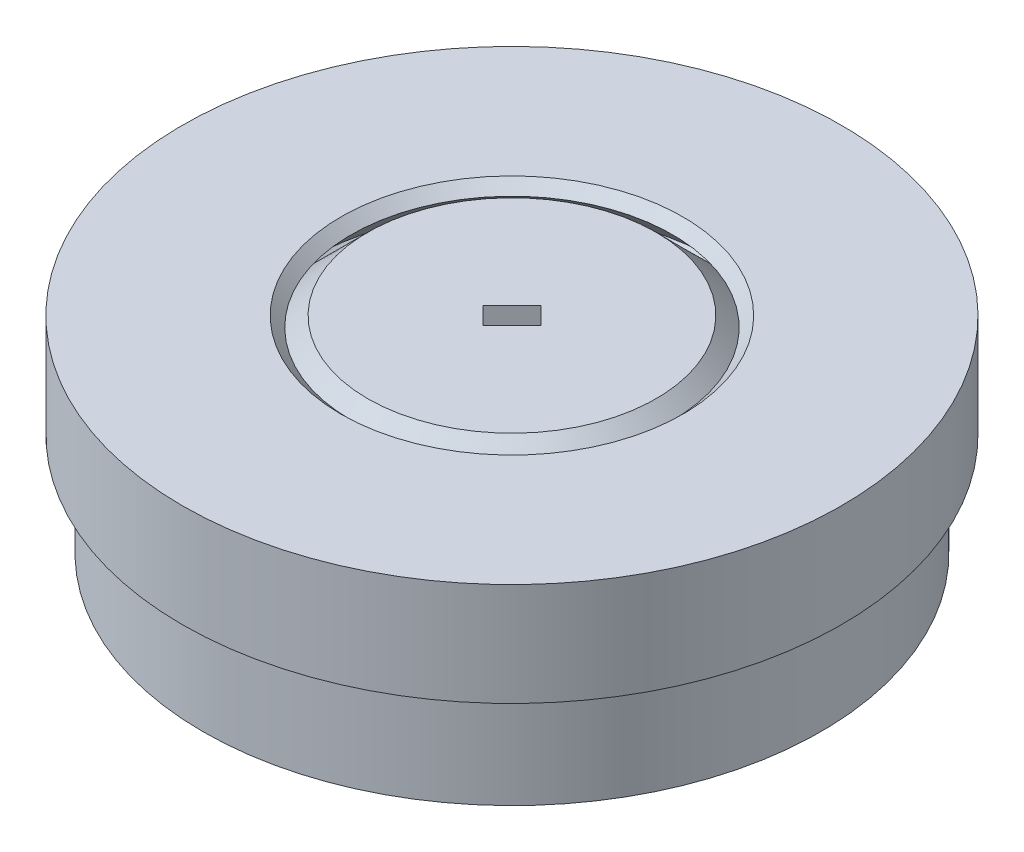
from build123d import *

# Parameters (mm, degrees)
SKETCH3_W             = 4
SKETCH3_H             = 4
BOSS_EXTRUDE1_DEPTH   = 3
SKETCH3_R             = 15
BOSS_EXTRUDE1_2_DEPTH = 3
FILLET2_R             = 0.5
FILLET3_R             = 0.5
CHAMFER1_SIZE         = 0.5
CHAMFER2_SIZE         = 1
CHAMFER2_SIZE2        = 0.707106781
CUT_EXTRUDE1_DEPTH    = 25.738633754


with BuildPart() as part:
    # Sketch3 → Boss-Extrude1 (new body)
    with BuildSketch(Plane(origin=(0, 0, 0), x_dir=(1, 0, 0), z_dir=(0, 1, 0))):
        Rectangle(SKETCH3_W, SKETCH3_H)
    extrude(amount=BOSS_EXTRUDE1_DEPTH)



with BuildPart() as body_2:
    # Sketch3 → Boss-Extrude1 2 (new body)
    with BuildSketch(Plane(origin=(0, 0, 0), x_dir=(1, 0, 0), z_dir=(0, 1, 0))):
        Circle(SKETCH3_R)
        with BuildLine():
            Line((0, 14), (6e-09, 11.000000002))
            add(Edge.make_bspline(
                [(0, 11), (0.056616489, 11.024574893), (0.170211242, 11.072370306), (0.437910475, 11.181792108), (0.663717143, 11.261861254), (0.97104166, 11.368516349), (1.234006284, 11.447229474), (1.52724598, 11.530520118), (1.805632628, 11.59890918), (2.095927746, 11.664153072), (2.381719097, 11.719222841), (2.672472662, 11.768403485), (2.962285544, 11.809180066), (3.254181451, 11.843127284), (3.594521396, 11.873714193), (4.008991563, 11.898575905), (4.497887113, 11.908766934), (4.985854779, 11.89703643), (5.426150855, 11.86840958), (5.789797413, 11.833835811), (6.08388825, 11.798119807), (6.441560531, 11.747794011), (6.813058519, 11.681533461), (7.156111535, 11.612501996), (7.536443848, 11.520476808), (7.779225286, 11.459012875), (8.050487558, 11.380265176), (8.170023598, 11.344456359), (8.228993532, 11.326237921)],
                knots=[0.074515509, 0.074515509, 0.074515509, 0.074515509, 0.074515509, 0.103872078, 0.133228686, 0.162585325, 0.191941925, 0.221298528, 0.250655154, 0.280011777, 0.309368359, 0.338724992, 0.36808162, 0.397438205, 0.426794822, 0.456151457, 0.50487246, 0.563585682, 0.622298905, 0.65165552, 0.681012134, 0.710368753, 0.739725372, 0.798438577, 0.827795195, 0.857151813, 0.88650843, 0.915865049, 0.915865049, 0.915865049, 0.915865049, 0.915865049], degree=4))
            Line((8.228993538, 11.326237921), (6.465637787, 8.899186936))
            add(Edge.make_bspline(
                [(6.465637788, 8.899186936), (6.52588625, 8.885790105), (6.645879774, 8.857688085), (6.926769524, 8.788862522), (7.156514419, 8.720913992), (7.467835468, 8.626558958), (7.726844732, 8.535672485), (8.013037641, 8.430694063), (8.278455252, 8.32239041), (8.551658334, 8.204542638), (8.815237592, 8.081111075), (9.079369825, 7.949998395), (9.337801244, 7.812639603), (9.593903667, 7.668531371), (9.887223001, 7.493229899), (10.237149757, 7.269723995), (10.638664701, 6.990603116), (11.026543819, 6.694292741), (11.365924387, 6.412333593), (11.63979868, 6.170616742), (11.856729825, 5.968859631), (12.116512018, 5.717910715), (12.378113229, 5.445943765), (12.615073272, 5.188454633), (12.868677528, 4.890450968), (13.028964244, 4.698022252), (13.202133296, 4.474870063), (13.277792089, 4.3756386), (13.314791239, 4.326237916)],
                knots=[0.074515508, 0.074515508, 0.074515508, 0.074515508, 0.074515508, 0.103872078, 0.133228686, 0.162585325, 0.191941925, 0.221298528, 0.250655154, 0.280011777, 0.309368359, 0.338724992, 0.36808162, 0.397438205, 0.426794822, 0.456151457, 0.50487246, 0.563585682, 0.622298905, 0.65165552, 0.681012134, 0.710368753, 0.739725372, 0.798438577, 0.827795195, 0.857151813, 0.88650843, 0.915865048, 0.915865048, 0.915865048, 0.915865048, 0.915865048], degree=4))
            Line((13.314791238, 4.326237917), (10.461621693, 3.399186929))
            add(Edge.make_bspline(
                [(10.461621694, 3.399186928), (10.502489264, 3.352935507), (10.583048111, 3.259670072), (10.769838042, 3.038886168), (10.915766422, 2.848873992), (11.112169944, 2.589549245), (11.268291112, 2.363778718), (11.438121271, 2.110629419), (11.589189339, 1.867001366), (11.740946093, 1.611075773), (11.881634939, 1.356289541), (12.018256305, 1.094964124), (12.146594243, 0.831936349), (12.269080761, 0.564817113), (12.403341467, 0.250586464), (12.555064686, -0.135915397), (12.715833963, -0.597733494), (12.855467892, -1.065443248), (12.96430111, -1.493035883), (13.043792468, -1.849568194), (13.100703597, -2.140302053), (13.163367733, -2.496020133), (13.215149396, -2.869811352), (13.255505784, -3.217406053), (13.285513777, -3.607560925), (13.302081693, -3.857453194), (13.311012833, -4.139773322), (13.313895292, -4.264524385), (13.31479124, -4.326237932)],
                knots=[0.074515508, 0.074515508, 0.074515508, 0.074515508, 0.074515508, 0.103872078, 0.133228686, 0.162585325, 0.191941925, 0.221298528, 0.250655154, 0.280011777, 0.309368359, 0.338724992, 0.36808162, 0.397438205, 0.426794822, 0.456151457, 0.50487246, 0.563585682, 0.622298905, 0.65165552, 0.681012134, 0.710368753, 0.739725372, 0.798438577, 0.827795195, 0.857151813, 0.88650843, 0.915865048, 0.915865048, 0.915865048, 0.915865048, 0.915865048], degree=4))
            Line((13.31479124, -4.326237931), (10.461621691, -3.399186954))
            add(Edge.make_bspline(
                [(10.461621691, -3.399186955), (10.467498346, -3.460626496), (10.477851776, -3.583431121), (10.499194481, -3.871841417), (10.505566666, -4.111339047), (10.512033191, -4.436580268), (10.505633283, -4.710998181), (10.494231343, -5.015623928), (10.473247001, -5.301518746), (10.445591505, -5.597767282), (10.409651583, -5.886588503), (10.366577363, -6.17830923), (10.315801089, -6.466538317), (10.257886016, -6.754638088), (10.181805068, -7.087772486), (10.077371636, -7.48963973), (9.935986847, -7.957756229), (9.774040173, -8.418216133), (9.610755451, -8.828116402), (9.465500875, -9.163280948), (9.340653871, -9.431941104), (9.182264381, -9.75655613), (9.004447661, -10.089396077), (8.832785625, -10.394326987), (8.627735322, -10.727607164), (8.494256057, -10.939512634), (8.335537893, -11.173164008), (8.264543016, -11.275784004), (8.228993541, -11.326237937)],
                knots=[0.074515508, 0.074515508, 0.074515508, 0.074515508, 0.074515508, 0.103872078, 0.133228686, 0.162585325, 0.191941925, 0.221298528, 0.250655154, 0.280011777, 0.309368359, 0.338724992, 0.36808162, 0.397438205, 0.426794822, 0.456151457, 0.50487246, 0.563585682, 0.622298905, 0.65165552, 0.681012134, 0.710368753, 0.739725372, 0.798438577, 0.827795195, 0.857151813, 0.88650843, 0.915865048, 0.915865048, 0.915865048, 0.915865048, 0.915865048], degree=4))
            Line((8.228993541, -11.326237937), (6.465637781, -8.899186959))
            add(Edge.make_bspline(
                [(6.465637781, -8.89918696), (6.434278838, -8.952346803), (6.370472192, -9.057783425), (6.218215484, -9.303657183), (6.082597515, -9.501160313), (5.89665705, -9.768086915), (5.730180614, -9.986333899), (5.541901729, -10.226079414), (5.356880282, -10.445038893), (5.160375995, -10.6684535), (4.961535133, -10.88098982), (4.755218216, -11.091678455), (4.544722541, -11.295015139), (4.328527466, -11.494051125), (4.071165201, -11.718843255), (3.750465139, -11.982576254), (3.360930468, -12.278186563), (2.959261315, -12.555516584), (2.586227867, -12.791156516), (2.27170967, -12.976931832), (2.012791845, -13.120899235), (1.69384813, -13.290419303), (1.35435297, -13.45517443), (1.036241574, -13.600968305), (0.674455221, -13.750072088), (0.441913317, -13.843050071), (0.176170794, -13.938785807), (0.058416211, -13.980077387), (3e-09, -14.000000019)],
                knots=[0.074515508, 0.074515508, 0.074515508, 0.074515508, 0.074515508, 0.103872078, 0.133228686, 0.162585325, 0.191941925, 0.221298528, 0.250655154, 0.280011777, 0.309368359, 0.338724992, 0.36808162, 0.397438205, 0.426794822, 0.456151457, 0.50487246, 0.563585682, 0.622298905, 0.65165552, 0.681012134, 0.710368753, 0.739725372, 0.798438577, 0.827795195, 0.857151813, 0.88650843, 0.915865048, 0.915865048, 0.915865048, 0.915865048, 0.915865048], degree=4))
            Line((4e-09, -14.000000018), (-1e-09, -11.000000021))
            add(Edge.make_bspline(
                [(-2e-09, -11.000000021), (-0.056616492, -11.024574914), (-0.170211245, -11.072370327), (-0.437910477, -11.181792129), (-0.663717146, -11.261861275), (-0.971041662, -11.36851637), (-1.234006287, -11.447229494), (-1.527245982, -11.530520138), (-1.80563263, -11.5989092), (-2.095927749, -11.664153092), (-2.3817191, -11.719222861), (-2.672472665, -11.768403505), (-2.962285547, -11.809180085), (-3.254181454, -11.843127304), (-3.594521399, -11.873714213), (-4.008991566, -11.898575924), (-4.497887115, -11.908766953), (-4.985854782, -11.897036449), (-5.426150858, -11.868409599), (-5.789797416, -11.833835829), (-6.083888253, -11.798119826), (-6.441560534, -11.747794029), (-6.813058522, -11.681533479), (-7.156111538, -11.612502014), (-7.53644385, -11.520476826), (-7.779225289, -11.459012893), (-8.050487561, -11.380265194), (-8.1700236, -11.344456376), (-8.228993535, -11.326237939)],
                knots=[0.074515508, 0.074515508, 0.074515508, 0.074515508, 0.074515508, 0.103872078, 0.133228686, 0.162585325, 0.191941925, 0.221298528, 0.250655154, 0.280011777, 0.309368359, 0.338724992, 0.36808162, 0.397438205, 0.426794822, 0.456151457, 0.50487246, 0.563585682, 0.622298905, 0.65165552, 0.681012134, 0.710368753, 0.739725372, 0.798438577, 0.827795195, 0.857151813, 0.88650843, 0.915865048, 0.915865048, 0.915865048, 0.915865048, 0.915865048], degree=4))
            Line((-8.228993534, -11.326237939), (-6.465637783, -8.899186955))
            add(Edge.make_bspline(
                [(-6.465637784, -8.899186954), (-6.525886246, -8.885790123), (-6.64587977, -8.857688104), (-6.92676952, -8.78886254), (-7.156514415, -8.72091401), (-7.467835464, -8.626558976), (-7.726844728, -8.535672503), (-8.013037637, -8.430694081), (-8.278455248, -8.322390428), (-8.55165833, -8.204542656), (-8.815237588, -8.081111094), (-9.07936982, -7.949998414), (-9.33780124, -7.812639622), (-9.593903663, -7.668531389), (-9.887222997, -7.493229917), (-10.237149753, -7.269724013), (-10.638664697, -6.990603135), (-11.026543815, -6.694292759), (-11.365924383, -6.412333611), (-11.639798676, -6.17061676), (-11.856729821, -5.96885965), (-12.116512014, -5.717910733), (-12.378113225, -5.445943783), (-12.615073268, -5.188454652), (-12.868677524, -4.890450986), (-13.02896424, -4.69802227), (-13.202133292, -4.474870081), (-13.277792085, -4.375638618), (-13.314791235, -4.326237934)],
                knots=[0.074515508, 0.074515508, 0.074515508, 0.074515508, 0.074515508, 0.103872078, 0.133228686, 0.162585325, 0.191941925, 0.221298528, 0.250655154, 0.280011777, 0.309368359, 0.338724992, 0.36808162, 0.397438205, 0.426794822, 0.456151457, 0.50487246, 0.563585682, 0.622298905, 0.65165552, 0.681012134, 0.710368753, 0.739725372, 0.798438577, 0.827795195, 0.857151813, 0.88650843, 0.915865048, 0.915865048, 0.915865048, 0.915865048, 0.915865048], degree=4))
            Line((-13.314791234, -4.326237935), (-10.461621689, -3.399186947))
            add(Edge.make_bspline(
                [(-10.46162169, -3.399186947), (-10.502489259, -3.352935525), (-10.583048107, -3.25967009), (-10.769838038, -3.038886187), (-10.915766418, -2.84887401), (-11.11216994, -2.589549263), (-11.268291108, -2.363778736), (-11.438121266, -2.110629438), (-11.589189335, -1.867001384), (-11.740946088, -1.611075792), (-11.881634935, -1.356289559), (-12.0182563, -1.094964142), (-12.146594239, -0.831936368), (-12.269080757, -0.564817131), (-12.403341463, -0.250586483), (-12.555064681, 0.135915379), (-12.715833959, 0.597733476), (-12.855467888, 1.06544323), (-12.964301106, 1.493035865), (-13.043792463, 1.849568176), (-13.100703592, 2.140302035), (-13.163367729, 2.496020115), (-13.215149392, 2.869811334), (-13.25550578, 3.217406035), (-13.285513773, 3.607560907), (-13.302081689, 3.857453176), (-13.311012829, 4.139773304), (-13.313895287, 4.264524367), (-13.314791235, 4.326237914)],
                knots=[0.074515508, 0.074515508, 0.074515508, 0.074515508, 0.074515508, 0.103872078, 0.133228686, 0.162585325, 0.191941925, 0.221298528, 0.250655154, 0.280011777, 0.309368359, 0.338724992, 0.36808162, 0.397438205, 0.426794822, 0.456151457, 0.50487246, 0.563585682, 0.622298905, 0.65165552, 0.681012134, 0.710368753, 0.739725372, 0.798438577, 0.827795195, 0.857151813, 0.88650843, 0.915865048, 0.915865048, 0.915865048, 0.915865048, 0.915865048], degree=4))
            Line((-13.314791235, 4.326237913), (-10.461621687, 3.399186936))
            add(Edge.make_bspline(
                [(-10.461621687, 3.399186937), (-10.467498342, 3.460626478), (-10.477851772, 3.583431102), (-10.499194477, 3.871841399), (-10.505566662, 4.111339029), (-10.512033187, 4.43658025), (-10.505633279, 4.710998163), (-10.494231339, 5.01562391), (-10.473246997, 5.301518728), (-10.4455915, 5.597767264), (-10.409651578, 5.886588485), (-10.366577358, 6.178309212), (-10.315801085, 6.466538299), (-10.257886012, 6.75463807), (-10.181805064, 7.087772468), (-10.077371632, 7.489639712), (-9.935986843, 7.957756211), (-9.774040169, 8.418216115), (-9.610755447, 8.828116384), (-9.465500871, 9.16328093), (-9.340653867, 9.431941085), (-9.182264377, 9.756556112), (-9.004447657, 10.089396058), (-8.832785621, 10.394326969), (-8.627735318, 10.727607146), (-8.494256053, 10.939512615), (-8.335537889, 11.173163989), (-8.264543012, 11.275783986), (-8.228993536, 11.326237919)],
                knots=[0.074515508, 0.074515508, 0.074515508, 0.074515508, 0.074515508, 0.103872078, 0.133228686, 0.162585325, 0.191941925, 0.221298528, 0.250655154, 0.280011777, 0.309368359, 0.338724992, 0.36808162, 0.397438205, 0.426794822, 0.456151457, 0.50487246, 0.563585682, 0.622298905, 0.65165552, 0.681012134, 0.710368753, 0.739725372, 0.798438577, 0.827795195, 0.857151813, 0.88650843, 0.915865048, 0.915865048, 0.915865048, 0.915865048, 0.915865048], degree=4))
            Line((-8.228993537, 11.326237918), (-6.465637777, 8.89918694))
            add(Edge.make_bspline(
                [(-6.465637777, 8.899186941), (-6.434278834, 8.952346785), (-6.370472187, 9.057783407), (-6.21821548, 9.303657165), (-6.082597511, 9.501160294), (-5.896657046, 9.768086897), (-5.73018061, 9.986333881), (-5.541901725, 10.226079395), (-5.356880278, 10.445038875), (-5.160375991, 10.668453482), (-4.961535129, 10.880989802), (-4.755218212, 11.091678437), (-4.544722537, 11.295015121), (-4.328527462, 11.494051107), (-4.071165196, 11.718843236), (-3.750465135, 11.982576235), (-3.360930464, 12.278186545), (-2.959261311, 12.555516565), (-2.586227863, 12.791156497), (-2.271709666, 12.976931814), (-2.012791841, 13.120899217), (-1.693848126, 13.290419284), (-1.354352966, 13.455174411), (-1.03624157, 13.600968287), (-0.674455217, 13.75007207), (-0.441913313, 13.843050053), (-0.176170789, 13.938785789), (-0.058416207, 13.980077368), (1e-09, 14)],
                knots=[0.074515508, 0.074515508, 0.074515508, 0.074515508, 0.074515508, 0.103872078, 0.133228686, 0.162585325, 0.191941925, 0.221298528, 0.250655154, 0.280011777, 0.309368359, 0.338724992, 0.36808162, 0.397438205, 0.426794822, 0.456151457, 0.50487246, 0.563585682, 0.622298905, 0.65165552, 0.681012134, 0.710368753, 0.739725372, 0.798438577, 0.827795195, 0.857151813, 0.88650843, 0.915865048, 0.915865048, 0.915865048, 0.915865048, 0.915865048], degree=4))
        make_face(mode=Mode.SUBTRACT)
    extrude(amount=BOSS_EXTRUDE1_2_DEPTH)


with BuildPart() as part_1:
    add(part.part)

    add(body_2.part)  # Revolve1 merges body 2
    # Sketch5 → Revolve1 (revolve)
    with BuildSketch(Plane(origin=(0, 0, 0), x_dir=(0, 0, -1), z_dir=(1, 0, 0))):
        Polygon((-7, 10), (-9.5, 7.5), (-7, 5), (-7, 3), (0, 3), (0, 10), align=None)
        Polygon((-7.3, 10), (-9.8, 7.5), (-7.3, 5), (-9.8, 5), (-9.8, 3), (-15, 3), (-15, 5), (-16, 5), (-16, 10), align=None)
    revolve(axis=Axis((0, 10, 0), (0, -1, 0)))

    # Fillet2
    fillet2_edges = [part_1.edges().sort_by_distance(p)[0] for p in [
        (0, 3, -9.8),
    ]]
    fillet(fillet2_edges, radius=FILLET2_R)

    # Fillet3
    fillet3_edges = [part_1.edges().sort_by_distance(p)[0] for p in [
        (0, 3, -7),
    ]]
    fillet(fillet3_edges, radius=FILLET3_R)

    # Chamfer1
    chamfer1_edges = [part_1.edges().sort_by_distance(p)[0] for p in [
        (2, 0, 0),
        (0, 0, -2),
        (-2, 0, 0),
        (0, 0, 2),
    ]]
    chamfer(chamfer1_edges, length=CHAMFER1_SIZE)

    # Chamfer2
    chamfer2_edges = [part_1.edges().sort_by_distance(p)[0] for p in [
        (0, 10, -7.3),
    ]]
    chamfer2_side = [part_1.faces().sort_by_distance(p)[0] for p in [
        (0, 10, -15.54745166),
    ]]
    chamfer(chamfer2_edges, length=CHAMFER2_SIZE, length2=CHAMFER2_SIZE2, reference=chamfer2_side[0])

    # Sketch6 → Cut-Extrude1 (cut, through all)
    with BuildSketch(Plane.XZ):
        Polygon((-0.282842712, 1.13137085), (1.13137085, -0.282842712), (0.282842712, -1.13137085), (-1.13137085, 0.282842712), align=None)
    extrude(amount=-CUT_EXTRUDE1_DEPTH, mode=Mode.SUBTRACT)


solid = part_1.part
